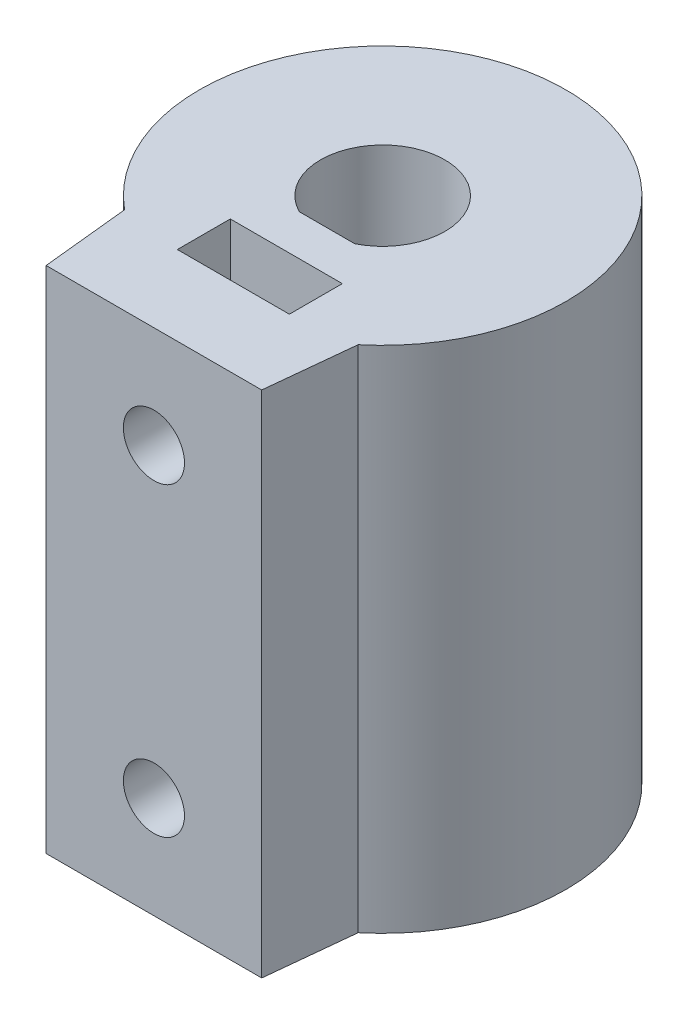
from build123d import *

# Parameters (mm, degrees)
SKETCH_1_R          = 6
SKETCH_1_R_2        = 3.05
EXTRUDE_1_DEPTH     = 25
SKETCH_2_W          = 4.705017592
SKETCH_2_H          = 2
EXTRUDE_2_DEPTH     = 12
SKETCH_4_W          = 10.5
SKETCH_4_H          = 6.5
EXTRUDE_3_DEPTH     = 25
SKETCH_6_R          = 1.5
CUT_EXTRUDE_3_DEPTH = 10
SKETCH_5_W          = 5.5
SKETCH_5_H          = 2.6
CUT_EXTRUDE_4_DEPTH = 5
CUT_EXTRUDE_8_DEPTH = 2.6
EXTRUDE_4_DEPTH     = 25
EXTRUDE_START       = 2
SKETCH_14_W         = 10.5
SKETCH_14_H         = 25
SKETCH_14_R         = 1.5
EXTRUDE_5_DEPTH     = 2
CUT_EXTRUDE_9_DEPTH = 30.391636651


with BuildPart() as part:
    # Эскиз1 → Бобышка-Вытянуть1 (new body)
    with BuildSketch(Plane(origin=(0, 0, 0), x_dir=(1, 0, 0), z_dir=(0, 1, 0))):
        with Locations(Location((0, 0, 0), (0, 0, 270))):
            Circle(SKETCH_1_R)
        with Locations(Location((0, 0, 0), (0, 0, 270))):
            Circle(SKETCH_1_R_2, mode=Mode.SUBTRACT)
    extrude(amount=EXTRUDE_1_DEPTH)

    # Эскиз2 → Бобышка-Вытянуть2 (add)
    with BuildSketch(Plane.XZ):
        with Locations((0.023466422, 3.73)):
            Rectangle(SKETCH_2_W, SKETCH_2_H)
    extrude(amount=-EXTRUDE_2_DEPTH)

    # Эскиз4 → Бобышка-Вытянуть3 (add, through all)
    with BuildSketch(Plane.XZ):
        with Locations((0, 5.98)):
            Rectangle(SKETCH_4_W, SKETCH_4_H)
    extrude(amount=-EXTRUDE_3_DEPTH)

    # Эскиз6 → Вырез-Вытянуть3 (cut)
    with BuildSketch(Plane.XY.offset(9.23)):
        with Locations((0, 5)):
            Circle(SKETCH_6_R)
    cut_extrude_3 = extrude(amount=-CUT_EXTRUDE_3_DEPTH, mode=Mode.SUBTRACT)

    # Эскиз5 → Вырез-Вытянуть4 (cut)
    with BuildSketch(Plane.XZ):
        with Locations((0, 6.03)):
            Rectangle(SKETCH_5_W, SKETCH_5_H)
    cut_extrude_4 = extrude(amount=-CUT_EXTRUDE_4_DEPTH, mode=Mode.SUBTRACT)

    # Эскиз11 → Вырез-Вытянуть8 (cut)
    with BuildSketch(Plane(origin=(0, 0, 7.33), x_dir=(-1, 0, 0), z_dir=(0, 0, -1))):
        Polygon((-2.75, 6.58771324), (-2.75, 7.08771324), (0, 8.675426481), (2.75, 7.08771324), (2.75, 6.58771324), (2.75, 3.41228676), (0, 1.824573519), (-2.75, 3.41228676), align=None)
    cut_extrude_8 = extrude(amount=CUT_EXTRUDE_8_DEPTH, mode=Mode.SUBTRACT)

    # Зеркальное отражение1: Вырез-Вытянуть3, Вырез-Вытянуть4, Вырез-Вытянуть8 across plane
    add(cut_extrude_3.mirror(Plane(origin=(0, 12.5, 0), x_dir=(0, 0, 1), z_dir=(0, -1, 0))), mode=Mode.SUBTRACT)
    add(cut_extrude_4.mirror(Plane(origin=(0, 12.5, 0), x_dir=(0, 0, 1), z_dir=(0, -1, 0))), mode=Mode.SUBTRACT)
    add(cut_extrude_8.mirror(Plane(origin=(0, 12.5, 0), x_dir=(0, 0, 1), z_dir=(0, -1, 0))), mode=Mode.SUBTRACT)

    # Эскиз13 → Бобышка-Вытянуть4 (add, through all)
    with BuildSketch(Plane(origin=(0, 25, 0), x_dir=(1, 0, 0), z_dir=(0, 1, 0))):
        with BuildLine():
            Line((-5.25, -2.90473751), (-5.25, -9.23))
            ThreePointArc((-5.25, -9.23), (0, 10.618634564), (5.25, -9.23))
            Line((5.25, -9.23), (5.25, -2.90473751))
            ThreePointArc((5.25, -2.90473751), (0, 6), (-5.25, -2.90473751))
        make_face()
    extrude(amount=-EXTRUDE_4_DEPTH)

    # Эскиз14 → Бобышка-Вытянуть5 (add)
    with BuildSketch(Plane.XY.offset(9.23).offset(EXTRUDE_START)):
        with Locations((0, 12.5)):
            Rectangle(SKETCH_14_W, SKETCH_14_H)
        with Locations((0, 20)):
            Circle(SKETCH_14_R, mode=Mode.SUBTRACT)
        with Locations((0, 5)):
            Circle(SKETCH_14_R, mode=Mode.SUBTRACT)
    extrude(amount=-EXTRUDE_5_DEPTH)

    # Эскиз15 → Вырез-Вытянуть9 (cut, through all)
    with BuildSketch(Plane.XZ):
        with BuildLine():
            Line((-5.25, 9.23), (-5.25, 7.310095759))
            ThreePointArc((-5.25, 7.310095759), (0, -9), (5.25, 7.310095759))
            Line((5.25, 7.310095759), (5.25, 9.23))
            ThreePointArc((5.25, 9.23), (0, -10.618634564), (-5.25, 9.23))
        make_face()
    extrude(amount=-CUT_EXTRUDE_9_DEPTH, mode=Mode.SUBTRACT)

    # Фаска1
    # the kernel refuses this chamfer: 4.36872896, 1 mm, written as the material it adds along each edge
    with BuildSketch(Plane(origin=(-5.25, 0, 7.310095759), x_dir=(0.003980651580542702, 0, 0.9999920771751115), z_dir=(0, 1, 0))) as chamfer_1_piece_1_section:
        with BuildLine():
            Line((4.499702082, 0), (-0.54914754, -0.499943041))
            Line((-0.54914754, -0.499943041), (-0.616269571, -0.444006022))
            ThreePointArc((-0.616269571, -0.444006022), (-0.289511406, -0.238197361), (-0.070765054, 0.051250602))
            Line((-0.070765054, 0.051250602), (0.000347808, 0.087373887))
            ThreePointArc((0.000347808, 0.087373887), (2.250163198, 0.078418085), (4.50004989, 0.087373887))
            Line((4.50004989, 0.087373887), (4.499702082, 0))
        make_face()
    chamfer_1_piece_1 = extrude(amount=25, mode=Mode.PRIVATE)
    chamfer_1_piece_1 = split(chamfer_1_piece_1, bisect_by=Plane(origin=(-5.368726711, 12.5, 11.23), z_dir=(0, 0, -1)), keep=Keep.TOP, mode=Mode.PRIVATE)
    add(chamfer_1_piece_1)

    # Фаска2
    # the kernel refuses this chamfer: 4.36872896, 1 mm, written as the material it adds along each edge
    with BuildSketch(Plane(origin=(5.25, 0, 7.310095759), x_dir=(-0.0039806515805427085, 0, 0.9999920771751115), z_dir=(0, 1, 0))) as chamfer_2_piece_1_section:
        with BuildLine():
            Line((4.499702082, 0), (-0.54914754, 0.499943041))
            Line((-0.54914754, 0.499943041), (-0.616269571, 0.444006022))
            ThreePointArc((-0.616269571, 0.444006022), (-0.289511406, 0.238197361), (-0.070765054, -0.051250602))
            Line((-0.070765054, -0.051250602), (0.000347808, -0.087373887))
            ThreePointArc((0.000347808, -0.087373887), (2.250163198, -0.078418085), (4.50004989, -0.087373887))
            Line((4.50004989, -0.087373887), (4.499702082, 0))
        make_face()
    chamfer_2_piece_1 = extrude(amount=25, mode=Mode.PRIVATE)
    chamfer_2_piece_1 = split(chamfer_2_piece_1, bisect_by=Plane(origin=(5.368726711, 12.5, 11.23), z_dir=(0, 0, -1)), keep=Keep.TOP, mode=Mode.PRIVATE)
    add(chamfer_2_piece_1)


solid = part.part
